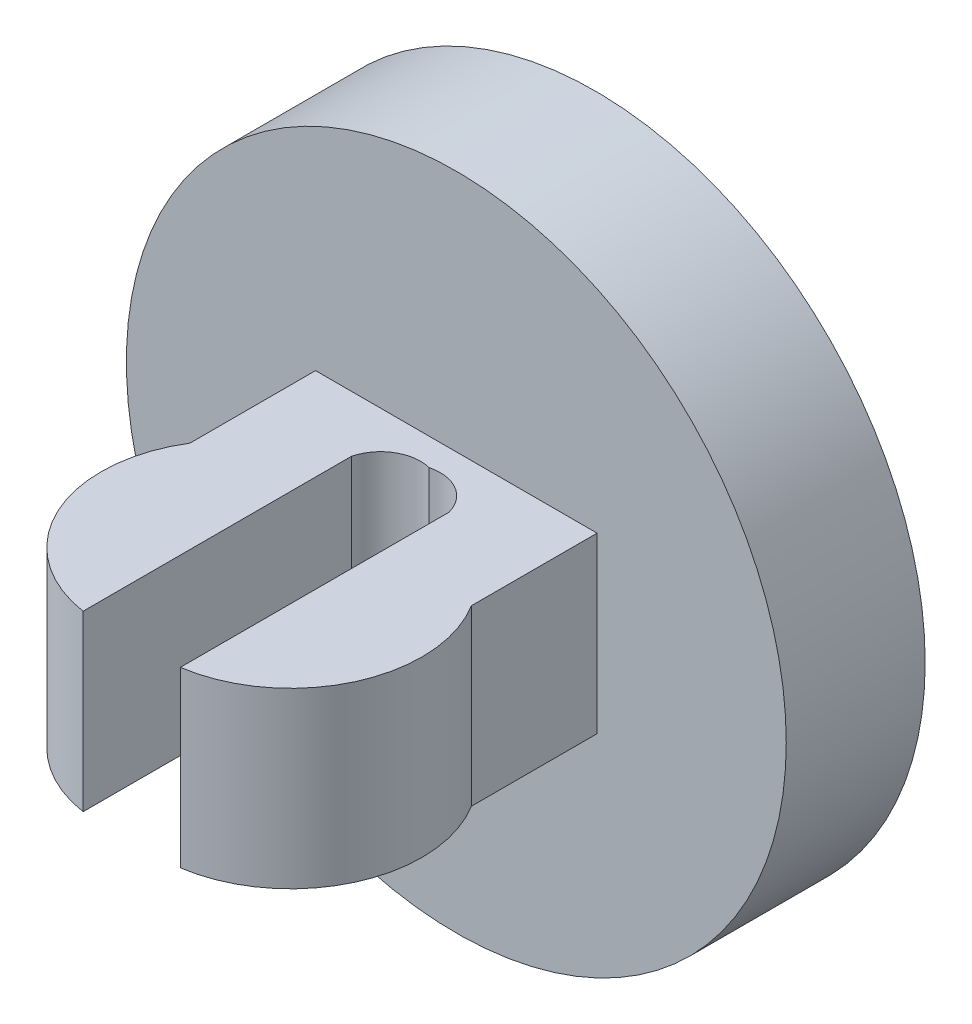
from build123d import *

# Parameters (mm, degrees)
SKETCH1_R           = 9.5
BOSS_EXTRUDE1_DEPTH = 4
BOSS_EXTRUDE2_DEPTH = 2.5


with BuildPart() as part:
    # Sketch1 → Boss-Extrude1 (new body)
    with BuildSketch(Plane.XY):
        Circle(SKETCH1_R)
    extrude(amount=BOSS_EXTRUDE1_DEPTH)

    # Sketch3 → Boss-Extrude2 (add, symmetric)
    with BuildSketch(Plane(origin=(0, 0, 0), x_dir=(1, 0, 0), z_dir=(0, 1, 0))):
        with BuildLine():
            Line((-4.053033857, -4), (4.053033857, -4))
            Line((4.053033857, -4), (4.053033857, -7.616562916))
            ThreePointArc((4.053033857, -7.616562916), (4.269234335, -11.195599289), (1.4, -13.345887254))
            Line((1.4, -13.345887254), (1.4, -5.618753706))
            ThreePointArc((1.4, -5.618753706), (0.873103679, -4.910894963), (0, -4.782935207))
            ThreePointArc((0, -4.782935207), (-0.873103679, -4.910894963), (-1.4, -5.618753706))
            Line((-1.4, -5.618753706), (-1.4, -13.345887254))
            ThreePointArc((-1.4, -13.345887254), (-4.269234335, -11.195599289), (-4.053033857, -7.616562916))
            Line((-4.053033857, -7.616562916), (-4.053033857, -4))
        make_face()
    extrude(amount=BOSS_EXTRUDE2_DEPTH, both=True)


solid = part.part
